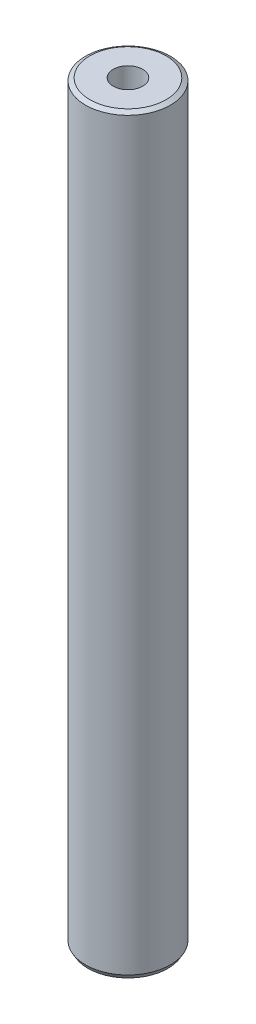
from build123d import *
from OCP.BRepFilletAPI import BRepFilletAPI_MakeChamfer

# Parameters (mm, degrees)
SKETCH1_R           = 20
BOSS_EXTRUDE1_DEPTH = 353.947255212
SKETCH2_R           = 6.930007175
CUT_EXTRUDE1_DEPTH  = 356.075568679
CHAMFER1_SIZE       = 1.189979528
CHAMFER1_SIZE2      = 2.061105002


with BuildPart() as part:
    # Sketch1 → Boss-Extrude1 (new body)
    with BuildSketch(Plane(origin=(0, 0, 0), x_dir=(1, 0, 0), z_dir=(0, 1, 0))):
        Circle(SKETCH1_R)
    extrude(amount=BOSS_EXTRUDE1_DEPTH)

    # Sketch2 → Cut-Extrude1 (cut, through all)
    with BuildSketch(Plane(origin=(0, 0, 0), x_dir=(1, 0, 0), z_dir=(0, 1, 0))):
        Circle(SKETCH2_R)
    extrude(amount=CUT_EXTRUDE1_DEPTH, mode=Mode.SUBTRACT)

    # Chamfer1: one chamfer whose edges measure the first distance from different faces: ONE call of the kernel's chamfer builder (chamfer() names one face for all edges)
    chamfer1_edges_1 = [part.edges().sort_by_distance(p)[0] for p in [
        (-20, 353.947255212, 0),
    ]]
    chamfer1_side_1 = [part.faces().sort_by_distance(p)[0] for p in [
        (-20, 176.973627606, 0),
    ]]
    chamfer1_edges_2 = [part.edges().sort_by_distance(p)[0] for p in [
        (-20, 0, 0),
    ]]
    chamfer1_side_2 = [part.faces().sort_by_distance(p)[0] for p in [
        (-19.434314575, 0, 0),
    ]]
    chamfer1 = BRepFilletAPI_MakeChamfer(part.part.solid().wrapped)
    for e in chamfer1_edges_1:
        chamfer1.Add(CHAMFER1_SIZE, CHAMFER1_SIZE2, e.wrapped, chamfer1_side_1[0].wrapped)  # the first distance lies on this face
    for e in chamfer1_edges_2:
        chamfer1.Add(CHAMFER1_SIZE, CHAMFER1_SIZE2, e.wrapped, chamfer1_side_2[0].wrapped)  # the first distance lies on this face
    add(Compound.cast(chamfer1.Shape()), mode=Mode.REPLACE)


solid = part.part
